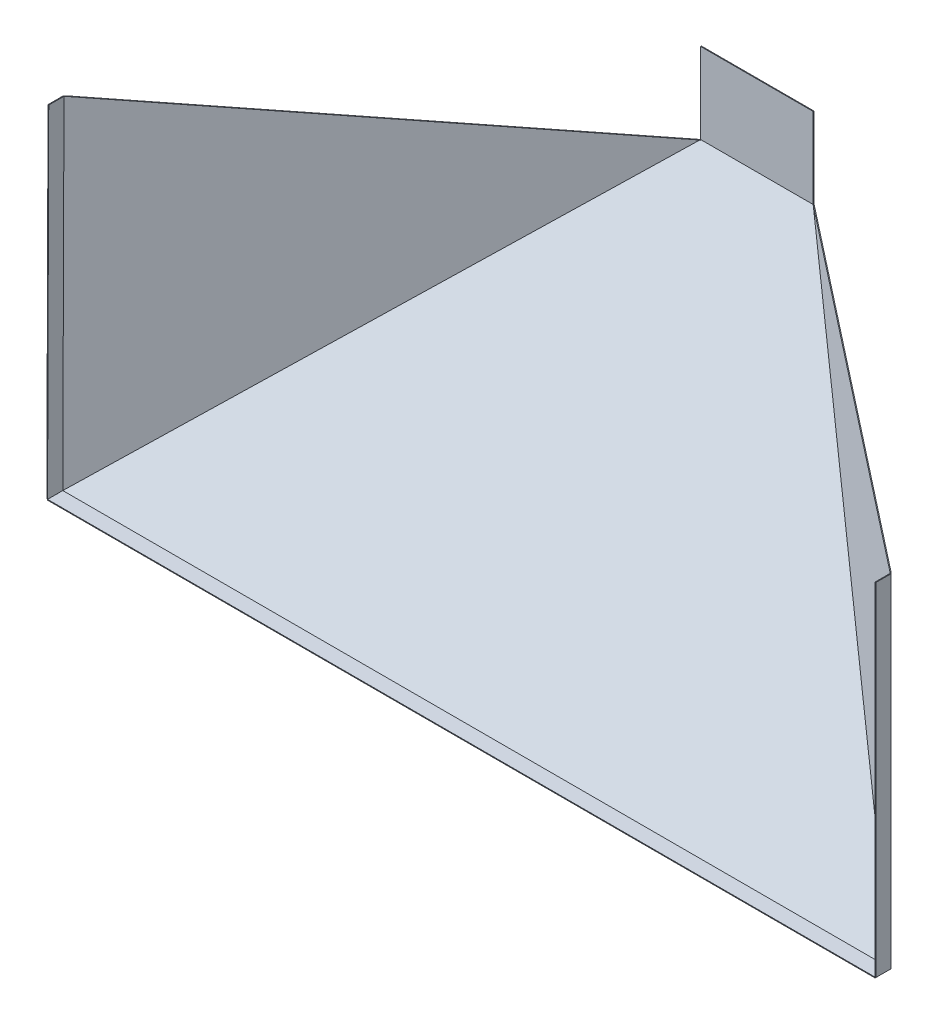
from build123d import *

# Parameters (mm, degrees)
SKETCH1_W               = 1088
SKETCH1_H               = 20
BOSS_EXTRUDE1_DEPTH     = 1
BOSS_EXTRUDE4_DEPTH     = 1088
SKETCH5_W               = 1088
SKETCH5_H               = 1
BOSS_EXTRUDE5_DEPTH     = 582
BOSS_EXTRUDE6_DEPTH     = 1088
SKETCH7_W               = 148
SKETCH7_H               = 1
BOSS_EXTRUDE7_DEPTH     = 106
CUT_EXTRUDE3_DEPTH      = 148
SKETCH13_W              = 470
SKETCH13_H              = 1
CUT_REVOLVE1_ANGLE      = 39.3
BOSS_EXTRUDE11_DEPTH    = 748.0802096
BOSS_EXTRUDE12_DEPTH    = 800
SKETCH18_W              = 570.021392147
SKETCH18_H              = 387.152750426
CUT_EXTRUDE5_DEPTH      = 1477.790454702
CUT_EXTRUDE6_DEPTH      = 800
CUT_EXTRUDE6_DEPTH_BACK = 10
BOSS_EXTRUDE13_DEPTH    = 748.0802096
BOSS_EXTRUDE14_DEPTH    = 748.0802096
SKETCH21_W              = 476.858853826
SKETCH21_H              = 325.647229621
CUT_EXTRUDE7_DEPTH      = 1432.718358443
CUT_EXTRUDE9_DEPTH      = 10
CUT_EXTRUDE9_DEPTH_BACK = 946.037072047
BOSS_EXTRUDE15_DEPTH    = 20
FILLET1_R               = 10
BOSS_EXTRUDE20_DEPTH    = 20
FILLET2_R               = 10


with BuildPart() as part:
    # Sketch1 → Boss-Extrude1 (new body)
    with BuildSketch(Plane(origin=(0, 0, 0), x_dir=(1, 0, 0), z_dir=(0, 1, 0))):
        Rectangle(SKETCH1_W, SKETCH1_H)
    extrude(amount=BOSS_EXTRUDE1_DEPTH)

    # Sketch4 → Boss-Extrude4 (add)
    with BuildSketch(Plane.ZY.offset(544)):
        with BuildLine():
            Line((-10, 1), (-10.77384021, 0.366619127))
            ThreePointArc((-10.77384021, 0.366619127), (-10.428146661, 0.096290735), (-10, 0))
            Line((-10, 0), (-10, 1))
        make_face()
    extrude(amount=-BOSS_EXTRUDE4_DEPTH)

    # Sketch5 → Boss-Extrude5 (add)
    with BuildSketch(Plane(origin=(0, 5.500184543, -4.501848885), x_dir=(1, 0, 0), z_dir=(0, 0.7738402097265025, -0.6333808726275548))):
        with Locations((0, 7.605021225)):
            Rectangle(SKETCH5_W, SKETCH5_H)
    extrude(amount=BOSS_EXTRUDE5_DEPTH)

    # Sketch6 → Boss-Extrude6 (add)
    with BuildSketch(Plane(origin=(544, 0, 0), x_dir=(0, 0, -1), z_dir=(1, 0, 0))):
        with BuildLine():
            Line((378.627667869, 451.375002061), (379.627667869, 451.375002061))
            ThreePointArc((379.627667869, 451.375002061), (379.569432227, 451.038728519), (379.401508079, 450.741621188))
            Line((379.401508079, 450.741621188), (378.627667869, 451.375002061))
        make_face()
    extrude(amount=-BOSS_EXTRUDE6_DEPTH)

    # Sketch7 → Boss-Extrude7 (add)
    with BuildSketch(Plane(origin=(0, 451.375002061, 0), x_dir=(1, 0, 0), z_dir=(0, 1, 0))):
        with Locations((0, 379.127667869)):
            Rectangle(SKETCH7_W, SKETCH7_H)
    extrude(amount=BOSS_EXTRUDE7_DEPTH)

    # Sketch8 → Cut-Extrude3 (cut)
    with BuildSketch(Plane(origin=(0, -4.500184543, -5.498151115), x_dir=(1, 0, 0), z_dir=(0, 0.6333808726275547, 0.7738402097265025))):
        Polygon((74, 589.107648936), (544, 7.107648936), (544, 589.107648936), align=None)
        Polygon((-74, 589.107648936), (-544, 7.107648936), (-544, 589.107648936), align=None)
    extrude(amount=-CUT_EXTRUDE3_DEPTH, mode=Mode.SUBTRACT)

    # Sketch13 → Cut-Revolve1 (revolve, cut)
    with BuildSketch(Plane(origin=(0, 451.375002061, 0), x_dir=(1, 0, 0), z_dir=(0, 1, 0))):
        with Locations((309, 379.127667869)):
            Rectangle(SKETCH13_W, SKETCH13_H)
        with Locations((-309, 379.127667869)):
            Rectangle(SKETCH13_W, SKETCH13_H)
    revolve(axis=Axis((-544, 451.375002061, -378.627667869), (-1, 0, 0)), revolution_arc=CUT_REVOLVE1_ANGLE, mode=Mode.SUBTRACT)

    # 3DSketch8 → Boss-Extrude11 (add)
    with BuildSketch(Plane(origin=(-74, 450.741621188, -379.401508079), x_dir=(0, 0.6333808726023494, 0.7738402097471327), z_dir=(-0.6282748747614416, -0.602041059623436, 0.49276489756372194))):
        with BuildLine():
            Line((0, 0), (1, 0))
            Line((1, 0), (0.393252863, 0.794894906))
            ThreePointArc((0.393252863, 0.794894906), (0.103688911, 0.443425791), (0, 0))
        make_face()
    extrude(amount=BOSS_EXTRUDE11_DEPTH)

    # Sketch17 → Boss-Extrude12 (add)
    with BuildSketch(Plane(origin=(-119.830134924, 202.692581564, 94.858610661), x_dir=(0.8810391406721232, 0.4420570737301439, 0.16839114041085765), z_dir=(-0.4720440788324485, 0.7984621982715473, 0.37367433089602736))):
        Polygon((69.885181219, 532.84001368), (70.561407095, 532.10331933), (70.579071373, 532.119533725), (69.90284514, 532.856227747), align=None)
        Polygon((-481.203373087, 26.984765587), (-480.527146854, 26.248071566), (70.561407095, 532.10331933), (69.885181219, 532.84001368), align=None)
    extrude(amount=BOSS_EXTRUDE12_DEPTH)

    # Sketch18 → Cut-Extrude5 (cut, through all)
    with BuildSketch(Plane(origin=(0, 1, 0), x_dir=(1, 0, 0), z_dir=(0, 1, 0))):
        with Locations((-773.718733555, -183.576375213)):
            Rectangle(SKETCH18_W, SKETCH18_H)
    extrude(amount=CUT_EXTRUDE5_DEPTH, mode=Mode.SUBTRACT)

    # 3DSketch9 → Cut-Extrude6 (cut, two sides: drawn at the far end of the back side and taken through both)
    with BuildSketch(Plane(origin=(-74, 450.741621188, -379.401508079), x_dir=(-0.7561274717373775, 0.6544243626913974, 3.634948491477008e-14), z_dir=(0, 0, 1)).offset(-CUT_EXTRUDE6_DEPTH_BACK)):
        Polygon((0, 0), (591.099614486, 511.59361742), (1033.881208267, 0), (442.781593781, -511.59361742), align=None)
    extrude(amount=CUT_EXTRUDE6_DEPTH + CUT_EXTRUDE6_DEPTH_BACK, mode=Mode.SUBTRACT)

    # 3DSketch11 → Boss-Extrude13 (add)
    with BuildSketch(Plane(origin=(74, 450.741621188, -379.401508079), x_dir=(0, 0.6333808726276229, 0.7738402097264466), z_dir=(-0.6282748747614613, 0.60204105960733, -0.4927648975833744))):
        with BuildLine():
            Line((0, 0), (1, 0))
            Line((1, 0), (0.391238571, 0.79335334))
            ThreePointArc((0.391238571, 0.79335334), (0.103127258, 0.44228869), (0, 0))
        make_face()
    extrude(amount=-BOSS_EXTRUDE13_DEPTH)

    # Sketch20 → Boss-Extrude14 (add)
    with BuildSketch(Plane(origin=(120.641152421, 203.389944625, 94.67657513), x_dir=(0.8807290157776859, -0.4307943838243474, -0.19680599491039222), z_dir=(0.47361118117402395, 0.7984651172491827, 0.37167984287985667))):
        Polygon((-54.061283152, 534.279462102), (-54.759673843, 533.563745369), (480.649426942, 11.115806908), (481.347817633, 11.831523641), align=None)
    extrude(amount=BOSS_EXTRUDE14_DEPTH)

    # Sketch21 → Cut-Extrude7 (cut, through all)
    with BuildSketch(Plane(origin=(0, 1, 0), x_dir=(1, 0, 0), z_dir=(0, 1, 0))):
        with Locations((750.93268392, -152.823614809)):
            Rectangle(SKETCH21_W, SKETCH21_H)
    extrude(amount=CUT_EXTRUDE7_DEPTH, mode=Mode.SUBTRACT)

    # 3DSketch12 → Cut-Extrude9 (cut, two sides: drawn at the far end of the back side and taken through both)
    with BuildSketch(Plane(origin=(74, 450.741621188, -379.401508079), x_dir=(0.7338585271859536, 0.6793023348086353, 3.7729204364225037e-14), z_dir=(0, 0, -1)).offset(-CUT_EXTRUDE9_DEPTH_BACK)):
        Polygon((0, 0), (611.708587654, 566.233213109), (1135.847136792, 0), (524.138549137, -566.233213109), align=None)
    extrude(amount=CUT_EXTRUDE9_DEPTH + CUT_EXTRUDE9_DEPTH_BACK, mode=Mode.SUBTRACT)

    # Sketch23 → Boss-Extrude15 (add)
    with BuildSketch(Plane.XY.offset(-10.000000002)):
        Polygon((543.999997701, 1.01026286), (543.899342545, 450.741621188), (544.899342545, 450.741845), (544.999997701, 1.010486671), align=None)
    extrude(amount=BOSS_EXTRUDE15_DEPTH)

    # Fillet1
    # the kernel refuses this fillet: 10 mm, written as the material it takes off along each edge
    with BuildSketch(Plane(origin=(545.517698589, 458.812119138, -10.000000002), x_dir=(-0.7867889291912172, -0.0001760925956154425, -0.6172221236261185), z_dir=(0.00022381172976857925, -0.9999999749541545, 0))) as fillet1_piece_1:
        with BuildLine():
            CenterArc((3.228199261, -10), FILLET1_R, 90, 15.90399317)
            Line((0.487936805, -0.382777861), (0, 0))
            Line((0, 0), (3.228199261, 0))
        make_face()
    extrude(amount=464.182000108, mode=Mode.SUBTRACT)

    # Sketch26 → Boss-Extrude20 (add)
    with BuildSketch(Plane.XY.offset(-10)):
        Polygon((-542.426656099, 450.741621188), (-543.999929799, 1.020067072), (-544.999929799, 1.023565401), (-543.426656099, 450.745119517), align=None)
    extrude(amount=BOSS_EXTRUDE20_DEPTH)

    # Fillet2
    # the kernel refuses this fillet: 10 mm, written as the material it takes off along each edge
    with BuildSketch(Plane(origin=(-544.015507205, 458.793802403, -10), x_dir=(0.7858388463706936, -0.0027491223803662495, -0.618425217678674), z_dir=(-0.003498307026844443, -0.9999938809052514, 0))) as fillet2_piece_1:
        with BuildLine():
            CenterArc((3.220892195, 10), FILLET2_R, 254.121260496, 15.878739504)
            Line((0.484868888, 0.381570998), (0, 0))
            Line((0, 0), (3.220892195, 0))
        make_face()
    extrude(amount=464.167480485, mode=Mode.SUBTRACT)


solid = part.part
